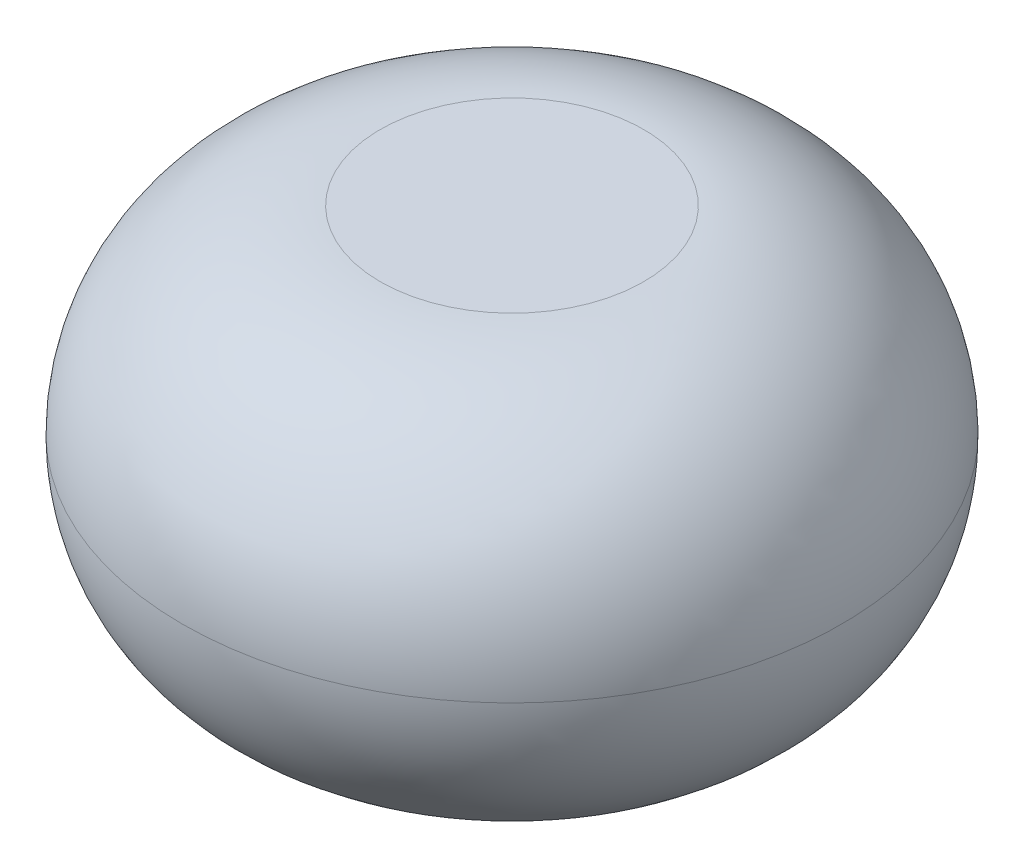
from build123d import *

# Parameters (mm, degrees)
SKETCH2_R           = 125
BOSS_EXTRUDE1_DEPTH = 150
FILLET2_R           = 75


with BuildPart() as part:
    # Sketch2 → Boss-Extrude1 (new body)
    with BuildSketch(Plane(origin=(0, 0, 0), x_dir=(1, 0, 0), z_dir=(0, 1, 0))):
        with Locations(Location((0, 0, 0), (0, 0, 270))):
            Circle(SKETCH2_R)
    extrude(amount=BOSS_EXTRUDE1_DEPTH)

    # Fillet2
    fillet2_edges = [part.edges().sort_by_distance(p)[0] for p in [
        (0, 0, -125),
        (0, 150, -125),
    ]]
    fillet(fillet2_edges, radius=FILLET2_R - 0.0001)  # a hair under: the kernel refuses the full size


solid = part.part
